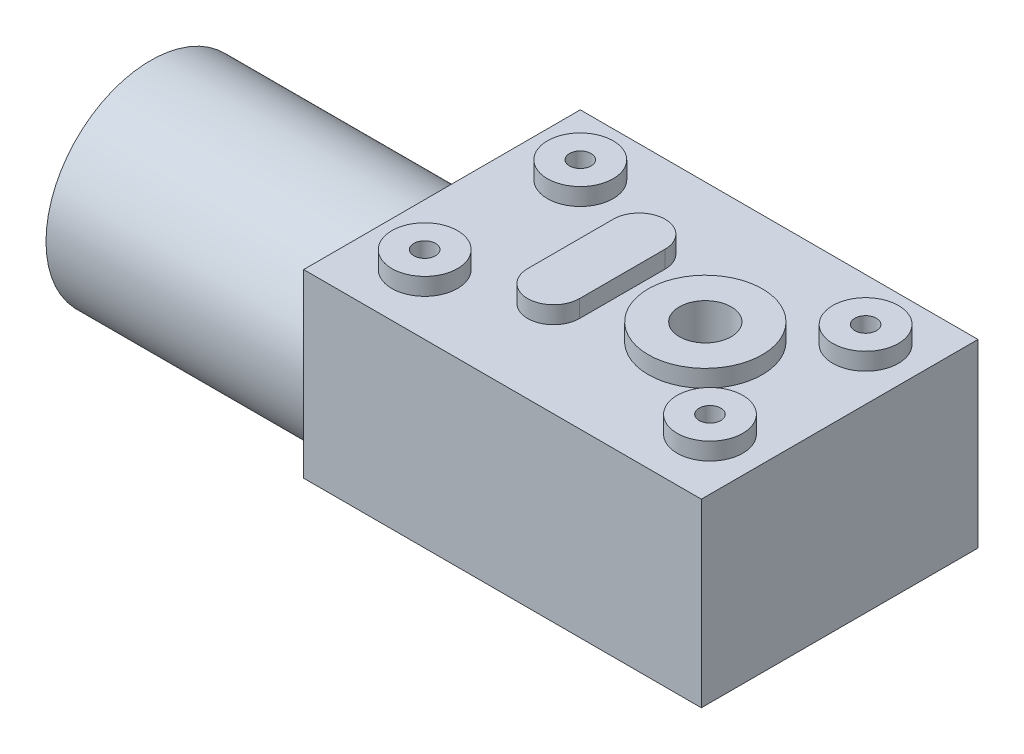
from build123d import *
from OCP.BRepFilletAPI import BRepFilletAPI_MakeChamfer

# Parameters (mm, degrees)
SKETCH1_W                       = 46
SKETCH1_H                       = 32
SKETCH1_R                       = 3
BOSS_EXTRUDE1_DEPTH             = 22.3
SKETCH3_R                       = 3.8
SKETCH3_R_2                     = 6.6
BOSS_EXTRUDE3_DEPTH             = 2
SKETCH4_R                       = 3
CUT_EXTRUDE1_DEPTH              = 36.809077062
SKETCH2_R                       = 12.1
BOSS_EXTRUDE2_DEPTH             = 30.8
CHAMFER1_SIZE                   = 1.4
CHAMFER1_SIZE2                  = 5.224871131
TAP_DRILL_FOR_M3X0_5_TAP1_D     = 2.5
TAP_DRILL_FOR_M3X0_5_TAP1_DEPTH = 2.6
TAP_DRILL_FOR_M3X0_5_TAP1_TIP   = 0.751075774
SKETCH8_R                       = 11.8
CUT_EXTRUDE2_DEPTH              = 0.8
SKETCH7_R                       = 3.2
BOSS_EXTRUDE5_DEPTH             = 2.7


with BuildPart() as part:
    # Sketch1 → Boss-Extrude1 (new body)
    with BuildSketch(Plane(origin=(0, 0, 0), x_dir=(1, 0, 0), z_dir=(0, 1, 0))):
        Rectangle(SKETCH1_W, SKETCH1_H)
        with Locations((7.460620525, 0)):
            Circle(SKETCH1_R, mode=Mode.SUBTRACT)
    extrude(amount=BOSS_EXTRUDE1_DEPTH)

    # Sketch3 → Boss-Extrude3 (add)
    with BuildSketch(Plane(origin=(0, 22.3, 0), x_dir=(1, 0, 0), z_dir=(0, 1, 0))):
        with Locations((-16, -9)):
            Circle(SKETCH3_R)
        with Locations((-16, 9)):
            Circle(SKETCH3_R)
        with Locations((17, 9)):
            Circle(SKETCH3_R)
        with Locations((17, -9)):
            Circle(SKETCH3_R)
        with Locations((7.460620525, 0)):
            Circle(SKETCH3_R_2)
        with BuildLine():
            Line((-8.139379475, -4.95), (-8.139379475, 4.95))
            ThreePointArc((-8.139379475, 4.95), (-5.139379475, 7.95), (-2.139379475, 4.95))
            Line((-2.139379475, 4.95), (-2.139379475, -4.95))
            ThreePointArc((-2.139379475, -4.95), (-5.139379475, -7.95), (-8.139379475, -4.95))
        make_face()
    extrude(amount=BOSS_EXTRUDE3_DEPTH)

    # Sketch4 → Cut-Extrude1 (cut, through all)
    with BuildSketch(Plane.XZ.offset(-22.3)):
        with Locations((7.460620525, 0)):
            Circle(SKETCH4_R)
    extrude(amount=-CUT_EXTRUDE1_DEPTH, mode=Mode.SUBTRACT)

    # Sketch2 → Boss-Extrude2 (add)
    with BuildSketch(Plane.ZY.offset(23)):
        with Locations((2.9, 9.2)):
            Circle(SKETCH2_R)
    extrude(amount=BOSS_EXTRUDE2_DEPTH)

    # Chamfer1: one chamfer whose edges measure the first distance from different faces: ONE call of the kernel's chamfer builder (chamfer() names one face for all edges)
    chamfer1_edges_1 = [part.edges().sort_by_distance(p)[0] for p in [
        (0, 0, 16),
    ]]
    chamfer1_side_1 = [part.faces().sort_by_distance(p)[0] for p in [
        (0, 11.15, 16),
    ]]
    chamfer1_edges_2 = [part.edges().sort_by_distance(p)[0] for p in [
        (23, 0, 0),
    ]]
    chamfer1_side_2 = [part.faces().sort_by_distance(p)[0] for p in [
        (23, 11.15, 0),
    ]]
    chamfer1_edges_3 = [part.edges().sort_by_distance(p)[0] for p in [
        (0, 0, -16),
    ]]
    chamfer1_side_3 = [part.faces().sort_by_distance(p)[0] for p in [
        (0, 11.15, -16),
    ]]
    chamfer1 = BRepFilletAPI_MakeChamfer(part.part.solid().wrapped)
    for e in chamfer1_edges_1:
        chamfer1.Add(CHAMFER1_SIZE, CHAMFER1_SIZE2, e.wrapped, chamfer1_side_1[0].wrapped)  # the first distance lies on this face
    for e in chamfer1_edges_2:
        chamfer1.Add(CHAMFER1_SIZE, CHAMFER1_SIZE2, e.wrapped, chamfer1_side_2[0].wrapped)  # the first distance lies on this face
    for e in chamfer1_edges_3:
        chamfer1.Add(CHAMFER1_SIZE, CHAMFER1_SIZE2, e.wrapped, chamfer1_side_3[0].wrapped)  # the first distance lies on this face
    add(Compound.cast(chamfer1.Shape()), mode=Mode.REPLACE)

    # Tap Drill for M3x0.5 Tap1
    with Locations(Plane(origin=(0, 24.3, 0), x_dir=(1, 0, 0), z_dir=(0, 1, 0))):
        with Locations((-16, -9), (17, 9), (17, -9), (-16, 9)):
            Hole(TAP_DRILL_FOR_M3X0_5_TAP1_D / 2, depth=TAP_DRILL_FOR_M3X0_5_TAP1_DEPTH)
            with Locations((0, 0, -(TAP_DRILL_FOR_M3X0_5_TAP1_DEPTH + TAP_DRILL_FOR_M3X0_5_TAP1_TIP / 2))):  # 118° drill point
                Cone(0, TAP_DRILL_FOR_M3X0_5_TAP1_D / 2, TAP_DRILL_FOR_M3X0_5_TAP1_TIP, mode=Mode.SUBTRACT)

    # Sketch8 → Cut-Extrude2 (cut)
    with BuildSketch(Plane.ZY.offset(53.8)):
        with Locations((2.9, 9.2)):
            Circle(SKETCH8_R)
    extrude(amount=-CUT_EXTRUDE2_DEPTH, mode=Mode.SUBTRACT)

    # Sketch7 → Boss-Extrude5 (add)
    with BuildSketch(Plane.ZY.offset(53)):
        with Locations((2.9, 9.2)):
            Circle(SKETCH7_R)
    extrude(amount=BOSS_EXTRUDE5_DEPTH)


solid = part.part
